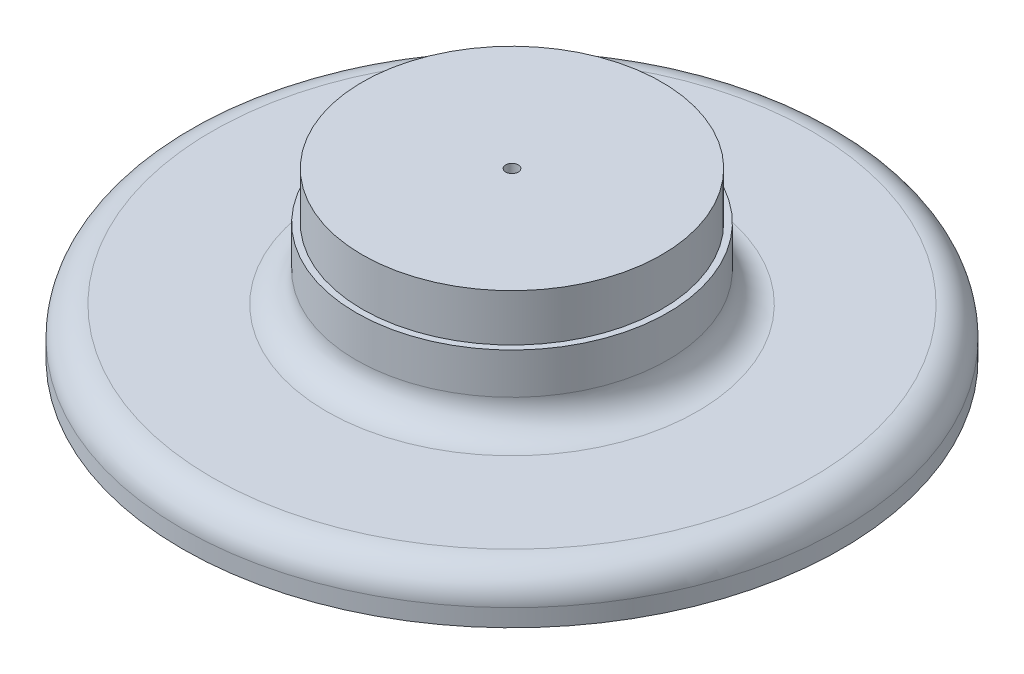
from build123d import *

# Parameters (mm, degrees)
SKETCH1_R                                           = 80.772
BOSS_EXTRUDE1_DEPTH                                 = 88.9
SKETCH1_3_R                                         = 84.074
SKETCH1_3_R_2                                       = 80.772
BOSS_EXTRUDE2_DEPTH                                 = 63.5
SKETCH1_4_R                                         = 177.8
SKETCH1_4_R_2                                       = 84.074
BOSS_EXTRUDE3_DEPTH                                 = 25.4
CSK_FOR_1_4_FLAT_HEAD_MACHINE_SCREW_100_D           = 6.7564
CSK_FOR_1_4_FLAT_HEAD_MACHINE_SCREW_100_CSINK_D     = 12.8778
CSK_FOR_1_4_FLAT_HEAD_MACHINE_SCREW_100_CSINK_ANGLE = 100
FILLET1_R                                           = 16.002
FILLET2_R                                           = 16.002


with BuildPart() as part:
    # Sketch1 → Boss-Extrude1 (new body)
    with BuildSketch(Plane(origin=(0, 0, 0), x_dir=(1, 0, 0), z_dir=(0, 1, 0))):
        Circle(SKETCH1_R)
    extrude(amount=BOSS_EXTRUDE1_DEPTH)

    # Sketch1<3> → Boss-Extrude2 (add)
    with BuildSketch(Plane(origin=(0, 0, 0), x_dir=(1, 0, 0), z_dir=(0, 1, 0))):
        Circle(SKETCH1_3_R)
        Circle(SKETCH1_3_R_2, mode=Mode.SUBTRACT)
    extrude(amount=BOSS_EXTRUDE2_DEPTH)

    # Sketch1<4> → Boss-Extrude3 (add)
    with BuildSketch(Plane(origin=(0, 0, 0), x_dir=(1, 0, 0), z_dir=(0, 1, 0))):
        Circle(SKETCH1_4_R)
        Circle(SKETCH1_4_R_2, mode=Mode.SUBTRACT)
    extrude(amount=BOSS_EXTRUDE3_DEPTH)

    # CSK for 1/4 Flat Head Machine Screw (100)1 (through all)
    with Locations(Plane(origin=(0, 0, 0), x_dir=(-1, 0, 0), z_dir=(0, -1, 0))):
        with Locations((0, 0)):
            CounterSinkHole(CSK_FOR_1_4_FLAT_HEAD_MACHINE_SCREW_100_D / 2, CSK_FOR_1_4_FLAT_HEAD_MACHINE_SCREW_100_CSINK_D / 2, counter_sink_angle=CSK_FOR_1_4_FLAT_HEAD_MACHINE_SCREW_100_CSINK_ANGLE)

    # Fillet1
    fillet1_edges = [part.edges().sort_by_distance(p)[0] for p in [
        (-84.074, 25.4, 0),
    ]]
    fillet(fillet1_edges, radius=FILLET1_R)

    # Fillet2
    fillet2_edges = [part.edges().sort_by_distance(p)[0] for p in [
        (-177.8, 25.4, 0),
    ]]
    fillet(fillet2_edges, radius=FILLET2_R)


solid = part.part
